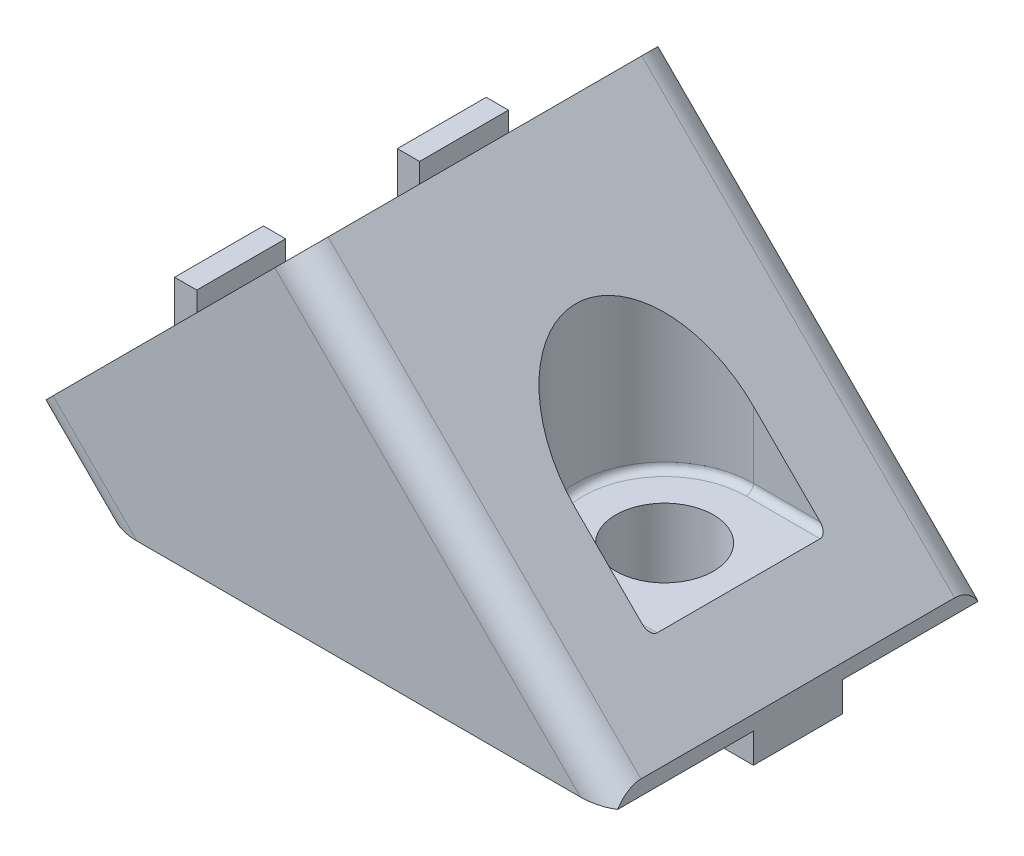
from build123d import *

# Parameters (mm, degrees)
BOSS_EXTRUDE1_DEPTH            = 12.7
CUT_EXTRUDE1_START             = 5
SKETCH2_R                      = 3.3
CUT_EXTRUDE1_DEPTH             = 49.250583245
CUT_EXTRUDE2_DEPTH             = 41.918070929
FILLET1_R                      = 2.1082
FILLET2_R                      = 0.5
SKETCH4_W                      = 7.5
SKETCH4_H                      = 2
SKETCH4_W_2                    = 3
BOSS_EXTRUDE4_DEPTH            = 3
CUT_EXTRUDE3_START             = -5
SKETCH5_R                      = 3.3
CUT_EXTRUDE3_DEPTH             = 50.856761932
CUT_EXTRUDE4_DEPTH             = 44.447671501
CUT_EXTRUDE4_DRAFT             = -1
CUT_EXTRUDE5_REACH             = 45.251
CUT_EXTRUDE5_DIRECTION_2_REACH = 45.251
FILLET3_R                      = 0.5
FILLET4_R                      = 0.5


with BuildPart() as part:
    # Sketch1 → Boss-Extrude1 (new, symmetric)
    with BuildSketch(Plane.XY):
        Polygon((0, 0), (-4.171930009, 4.171930009), (13.788582233, 22.132442251), (34.921024484, 1), (34.921024484, 0), align=None)
    extrude(amount=BOSS_EXTRUDE1_DEPTH, both=True)

    # Sketch2 → Cut-Extrude1 (cut, through all)
    with BuildSketch(Plane(origin=(0, 0, 0), x_dir=(1, 0, 0), z_dir=(0, 1, 0)).offset(CUT_EXTRUDE1_START)):
        with Locations(Location((25.921024484, 0, 0), (0, 0, 270))):
            Circle(SKETCH2_R)
    extrude(amount=-CUT_EXTRUDE1_DEPTH, mode=Mode.SUBTRACT)

    # Sketch3 → Cut-Extrude2 (cut, through all)
    with BuildSketch(Plane.XZ.offset(-5)):
        with BuildLine():
            Line((25.921024484, -6), (35.921024484, -6))
            Line((35.921024484, -6), (35.921024484, 6))
            Line((35.921024484, 6), (25.921024484, 6))
            ThreePointArc((25.921024484, 6), (19.921024484, 0), (25.921024484, -6))
        make_face()
    extrude(amount=-CUT_EXTRUDE2_DEPTH, mode=Mode.SUBTRACT)

    # Fillet1
    fillet1_edges = [part.edges().sort_by_distance(p)[0] for p in [
        (-2.085965005, 2.085965005, -12.7),
        (-2.085965005, 2.085965005, 12.7),
        (24.354803359, 11.566221126, -12.7),
        (24.354803359, 11.566221126, 12.7),
    ]]
    fillet(fillet1_edges, radius=FILLET1_R)

    # Fillet2
    fillet2_edges = [part.edges().sort_by_distance(p)[0] for p in [
        (28.421024484, 5, -6),
        (28.421024484, 5, 6),
        (19.921024484, 5, 0),
    ]]
    fillet(fillet2_edges, radius=FILLET2_R)

    # Sketch4 → Boss-Extrude4 (add, symmetric)
    with BuildSketch(Plane.XY):
        with Locations((3.75, -1)):
            Rectangle(SKETCH4_W, SKETCH4_H)
        with Locations((33.421024484, -1)):
            Rectangle(SKETCH4_W_2, SKETCH4_H)
        Polygon((-4.171930009, 7.000357134), (-2.671930009, 7.000357134), (-2.671930009, 5.671930009), (-4.171930009, 4.171930009), align=None)
        Polygon((10.874368671, 22.046655814), (12.374368671, 22.046655814), (12.374368671, 20.718228689), (10.874368671, 19.218228689), align=None)
    extrude(amount=BOSS_EXTRUDE4_DEPTH, both=True)

    # Sketch5 → Cut-Extrude3 (cut, through all)
    with BuildSketch(Plane(origin=(-4.171930009, 4.171930009, 0), x_dir=(0, 0, 1), z_dir=(-0.7071067811865477, 0.7071067811865475, 0)).offset(CUT_EXTRUDE3_START)):
        with Locations(Location((0, 12.7, 0), (0, 0, 90))):
            Circle(SKETCH5_R)
    extrude(amount=CUT_EXTRUDE3_DEPTH, mode=Mode.SUBTRACT)


with BuildPart() as cut_extrude4_tool:
    # Sketch6 → Cut-Extrude4 (with draft: the straight prism first)
    with BuildSketch(Plane(origin=(-0.636396103, 0.636396103, 0), x_dir=(0, 0, 1), z_dir=(-0.7071067811865476, 0.7071067811865476, 0))):
        with BuildLine():
            Line((-4.25, 12.7), (-4.25, 8.45))
            Line((-4.25, 8.45), (4.25, 8.45))
            Line((4.25, 8.45), (4.25, 12.7))
            ThreePointArc((4.25, 12.7), (0, 16.95), (-4.25, 12.7))
        make_face()
    extrude(amount=-CUT_EXTRUDE4_DEPTH)
    # Cut-Extrude4: the draft: its side faces are tilted about the plane it starts from
    cut_extrude4_sides = [cut_extrude4_tool.faces().sort_by_distance(p)[0] for p in [
        (22.555883071, -7.600574649, -4.25),
        (21.053281161, -9.103176559, 0),
        (22.555883071, -7.600574649, 4.25),
        (27.063688801, -3.092768919, 0),
    ]]
    draft(cut_extrude4_sides, Plane(origin=(-0.636396103, 0.636396103, 0), x_dir=(0, 0, 1), z_dir=(-0.7071067811865476, 0.7071067811865476, 0)), CUT_EXTRUDE4_DRAFT)


with BuildPart() as part_1:
    add(part.part)

    # Cut-Extrude4: cut by cut_extrude4_tool
    add(cut_extrude4_tool.part, mode=Mode.SUBTRACT)

    # Cut-Extrude5: up to this plane
    cut_extrude5_end = Plane(origin=(8.343860018, 9.616652224, 4.25), z_dir=(0.012340714939826952, -0.012340714939826952, 0.9998476951563913))
    # Sketch7 → Cut-Extrude5 (cut, up to the surface)
    with BuildSketch(Plane.XY, mode=Mode.PRIVATE) as cut_extrude5_sk1:
        Polygon((12.185011438, 0), (7.5, 0), (5.338656198, 6.611448404), align=None)
    cut_extrude5_tool1 = split(extrude(cut_extrude5_sk1.sketch, amount=CUT_EXTRUDE5_REACH, mode=Mode.PRIVATE), bisect_by=cut_extrude5_end, keep=Keep.BOTH, mode=Mode.PRIVATE)
    add(cut_extrude5_tool1.solids().sort_by_distance((8.341223, 2.203816, 0))[0], mode=Mode.SUBTRACT)

    # Cut-Extrude5 direction 2: up to this plane
    cut_extrude5_direction_2_end = Plane(origin=(8.343860018, 9.616652224, -4.25), z_dir=(0.012340714939826952, -0.012340714939826952, -0.9998476951563913))
    # Sketch7 → Cut-Extrude5 direction 2 (cut, up to the surface)
    with BuildSketch(Plane.XY, mode=Mode.PRIVATE) as cut_extrude5_direction_2_sk1:
        Polygon((12.185011438, 0), (7.5, 0), (5.338656198, 6.611448404), align=None)
    cut_extrude5_direction_2_tool1 = split(extrude(cut_extrude5_direction_2_sk1.sketch, amount=-CUT_EXTRUDE5_DIRECTION_2_REACH, mode=Mode.PRIVATE), bisect_by=cut_extrude5_direction_2_end, keep=Keep.BOTH, mode=Mode.PRIVATE)
    add(cut_extrude5_direction_2_tool1.solids().sort_by_distance((8.341223, 2.203816, 0))[0], mode=Mode.SUBTRACT)

    # Fillet3
    fillet3_edges = [part_1.edges().sort_by_distance(p)[0] for p in [
        (11.349063838, 12.621856044, 0),
        (6.841258108, 8.114050314, -4.25),
        (6.841258108, 8.114050314, 4.25),
    ]]
    fillet(fillet3_edges, radius=FILLET3_R)

    # Fillet4
    # the kernel refuses this fillet: 0.5 mm, written as the material it adds along each edge
    with BuildSketch(Plane(origin=(7.891440115, -1.197396785, 4.122110611), x_dir=(0.9504313899021286, 0.31083412501895896, -0.007894289860799094), z_dir=(-0.3106893622953352, 0.9503840557787532, 0.015564918183075198))) as fillet4_piece_1_section:
        with BuildLine():
            CenterArc((FILLET4_R * 1.0079266613, FILLET4_R), FILLET4_R, 179.547631009, 90.452368991)
            Line((FILLET4_R * 0.00795782923952, FILLET4_R * 1.0078952463), (0, 0))
            Line((0, 0), (FILLET4_R * 1.0079266613, 0))
        make_face()
    fillet4_piece_1 = extrude(amount=8.905919631, mode=Mode.PRIVATE)
    fillet4_piece_1 = split(fillet4_piece_1, bisect_by=Plane(origin=(6.661619064, 0, 4.078163778), z_dir=(0, 1, 0)), keep=Keep.TOP, mode=Mode.PRIVATE)
    add(fillet4_piece_1)
    with BuildSketch(Plane(origin=(7.891440115, -1.197396785, -4.122110611), x_dir=(-0.004836440394139795, 0.014794442279442568, 0.9998788593234452), z_dir=(-0.3106893622953352, 0.9503840557787532, -0.015564918183075198))) as fillet4_piece_2_section:
        with BuildLine():
            CenterArc((FILLET4_R * 1.0079266613, FILLET4_R), FILLET4_R, 179.547631009, 90.452368991)
            Line((FILLET4_R * 0.00795782923952, FILLET4_R * 1.0078952463), (0, 0))
            Line((0, 0), (FILLET4_R * 1.0079266613, 0))
        make_face()
    fillet4_piece_2 = extrude(amount=8.905919631, mode=Mode.PRIVATE)
    fillet4_piece_2 = split(fillet4_piece_2, bisect_by=Plane(origin=(6.661619064, 0, -4.078163778), z_dir=(0, 1, 0)), keep=Keep.TOP, mode=Mode.PRIVATE)
    add(fillet4_piece_2)


solid = part_1.part
